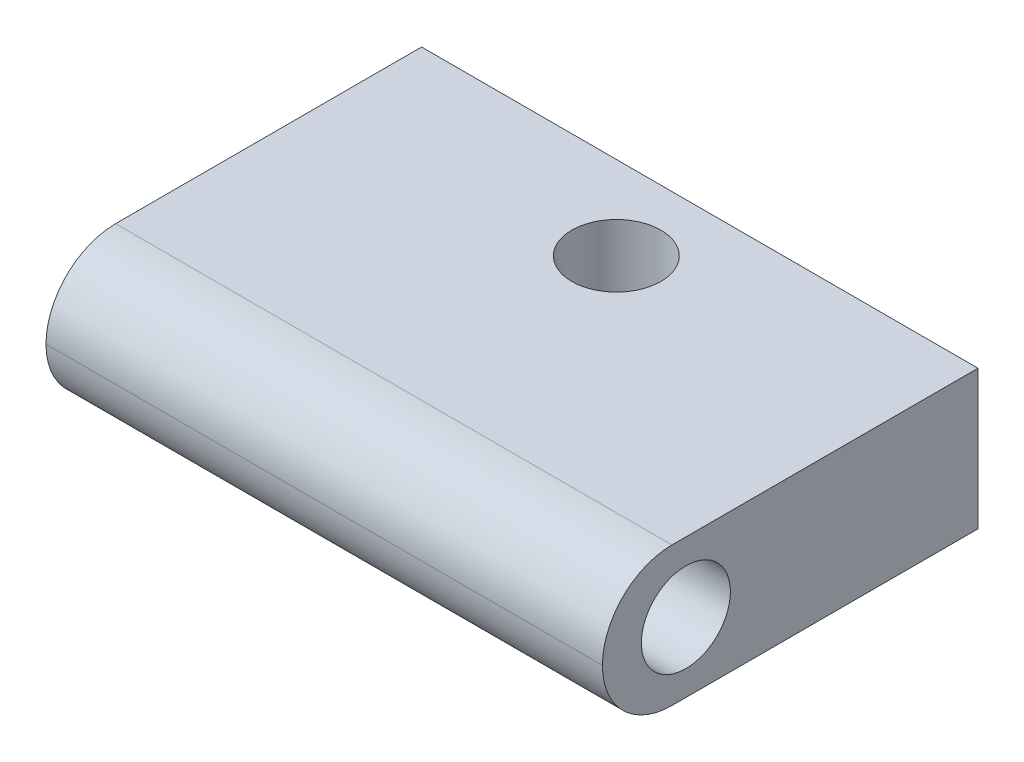
from build123d import *

# Parameters (mm, degrees)
SKETCH1_W                  = 20
SKETCH1_H                  = 13.5
BOSS_EXTRUDE1_DEPTH        = 5
F_3_2_3_2_M2_HEAT_SET_D    = 3.2
FILLET2_R                  = 2.5
F_3_2_3_2_DIAMETER_HOLE1_D = 3.2


with BuildPart() as part:
    # Sketch1 → Boss-Extrude1 (new body)
    with BuildSketch(Plane(origin=(0, 0, 0), x_dir=(1, 0, 0), z_dir=(0, 1, 0))):
        Rectangle(SKETCH1_W, SKETCH1_H)
    extrude(amount=BOSS_EXTRUDE1_DEPTH)

    # Ø3.2 (3.2) M2 heat set (through all)
    with Locations(Plane(origin=(0, 5, 0), x_dir=(1, 0, 0), z_dir=(0, 1, 0))):
        with Locations((0, 3.75)):
            Hole(F_3_2_3_2_M2_HEAT_SET_D / 2)

    # Fillet2
    fillet2_edges = [part.edges().sort_by_distance(p)[0] for p in [
        (0, 0, 6.75),
        (0, 5, 6.75),
    ]]
    fillet(fillet2_edges, radius=FILLET2_R - 0.0001)  # a hair under: the kernel refuses the full size

    # Ø3.2 (3.2) Diameter Hole1 (through all)
    with Locations(Plane(origin=(10, 0, 0), x_dir=(0, 0, -1), z_dir=(1, 0, 0))):
        with Locations((-3.75, 2.5)):
            Hole(F_3_2_3_2_DIAMETER_HOLE1_D / 2)


solid = part.part
